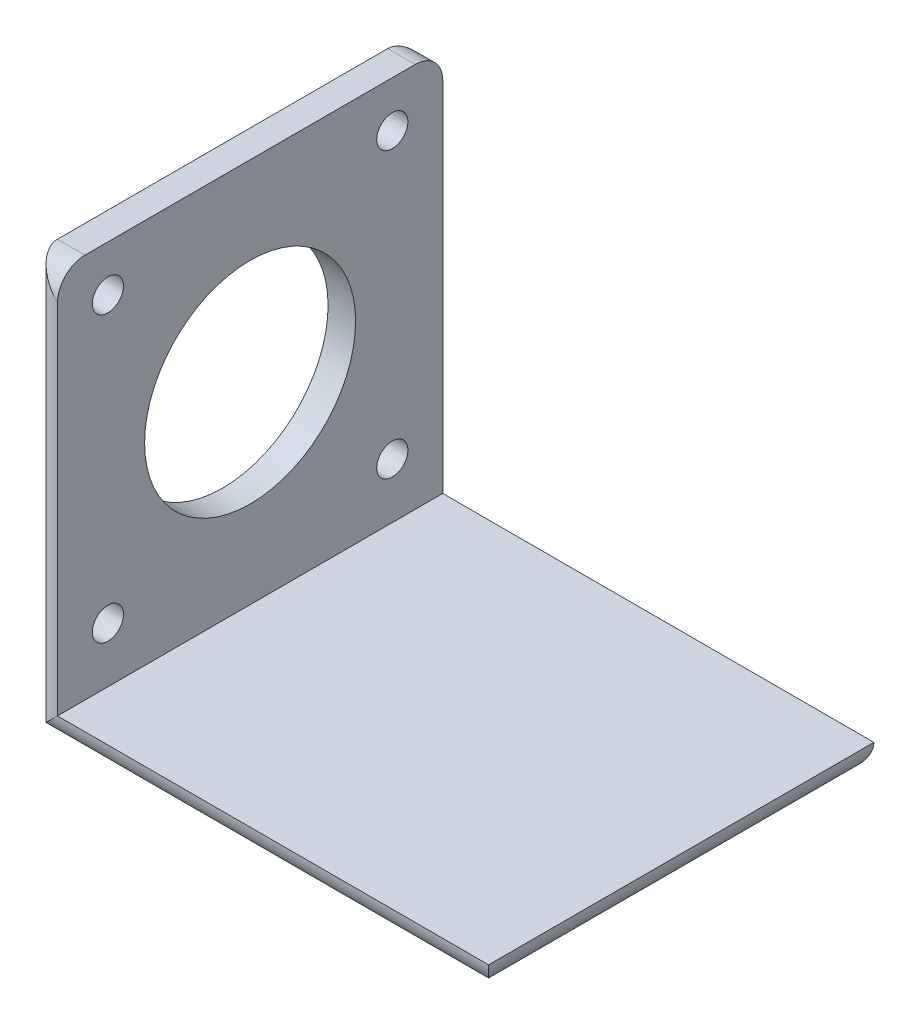
from build123d import *

# Parameters (mm, degrees)
BOSS_EXTRUDE1_DEPTH = 21
FILLET1_R           = 3
SKETCH2_R           = 11.5
SKETCH2_R_2         = 1.7
CUT_EXTRUDE2_DEPTH  = 69.373971656


with BuildPart() as part:
    # Sketch1 → Boss-Extrude1 (new, symmetric)
    with BuildSketch(Plane.XY):
        Polygon((0, 0), (0, 45), (3, 45), (3, 3), (50, 3), (50, 0), align=None)
    extrude(amount=BOSS_EXTRUDE1_DEPTH, both=True)

    # Fillet1
    fillet1_edges = [part.edges().sort_by_distance(p)[0] for p in [
        (0, 22.5, -21),
        (25, 0, -21),
        (50, 0, 0),
        (0, 22.5, 21),
        (25, 0, 21),
        (1.5, 45, -21),
        (1.5, 45, 21),
    ]]
    fillet(fillet1_edges, radius=FILLET1_R - 0.0001)  # a hair under: the kernel refuses the full size

    # Sketch2 → Cut-Extrude2 (cut, through all)
    with BuildSketch(Plane(origin=(3, 0, 0), x_dir=(0, 0, -1), z_dir=(1, 0, 0))):
        with Locations(Location((0, 24, 0), (0, 0, 90))):
            Circle(SKETCH2_R)
        with Locations(Location((-15.5, 40, 0), (0, 0, 90))):
            Circle(SKETCH2_R_2)
        with Locations(Location((-15.5, 9, 0), (0, 0, 270))):
            Circle(SKETCH2_R_2)
        with Locations(Location((15.5, 9, 0), (0, 0, 90))):
            Circle(SKETCH2_R_2)
        with Locations(Location((15.5, 40, 0), (0, 0, 270))):
            Circle(SKETCH2_R_2)
    extrude(amount=-CUT_EXTRUDE2_DEPTH, mode=Mode.SUBTRACT)


solid = part.part
